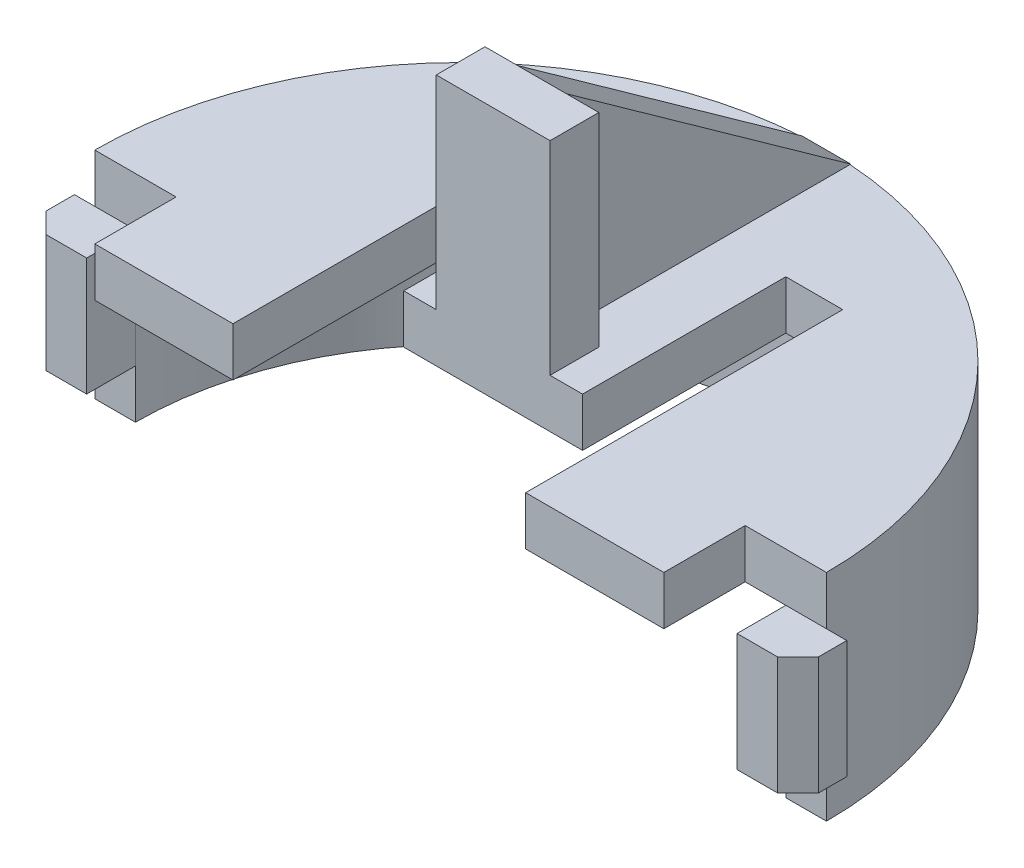
from build123d import *

# Parameters (mm, degrees)
REVOLVE1_ANGLE           = 180
SKETCH2_W                = 6.21
SKETCH2_H                = 1.5
CUT_EXTRUDE1_DEPTH       = 14.787313009
CUT_EXTRUDE2_DEPTH       = 14.787313009
SKETCH4_W                = 3.4
SKETCH4_H                = 2
BOSS_EXTRUDE1_DEPTH      = 1.2
SKETCH5_W                = 1.2
SKETCH5_H                = 2.9
BOSS_EXTRUDE2_DEPTH      = 1.5
CHAMFER1_SIZE            = 0.5
CHAMFER1_OF_MIRROR2_SIZE = 0.5
SKETCH6_W                = 2.8
SKETCH6_H                = 5
BOSS_EXTRUDE3_DEPTH      = 1.2
BOSS_EXTRUDE4_DEPTH      = 0.6


with BuildPart() as part:
    # Sketch1 → Revolve1 (revolve)
    with BuildSketch(Plane.XY):
        Polygon((8, 4.1), (8, 0), (9, 0), (9, 5.3), (0, 5.3), (0, 4.1), align=None)
    revolve(axis=Axis((0, 0, 0), (0, 1, 0)), revolution_arc=REVOLVE1_ANGLE)

    # Sketch2 → Cut-Extrude1 (cut, through all)
    with BuildSketch(Plane.XY):
        with Locations((0, 3.35)):
            Rectangle(SKETCH2_W, SKETCH2_H)
    extrude(amount=-CUT_EXTRUDE1_DEPTH, mode=Mode.SUBTRACT)

    # Sketch3 → Cut-Extrude2 (cut, through all)
    with BuildSketch(Plane(origin=(0, 5.3, 0), x_dir=(1, 0, 0), z_dir=(0, 1, 0))):
        Polygon((-2.2, 5.8), (-3.6, 5.8), (-3.6, 0), (3.6, 0), (3.6, 5.8), (2.2, 5.8), (2.2, 0.8), (-2.2, 0.8), align=None)
    extrude(amount=-CUT_EXTRUDE2_DEPTH, mode=Mode.SUBTRACT)

    # Sketch4 → Boss-Extrude1 (add)
    with BuildSketch(Plane(origin=(0, 5.3, 0), x_dir=(1, 0, 0), z_dir=(0, 1, 0))):
        with Locations((5.3, -1)):
            Rectangle(SKETCH4_W, SKETCH4_H)
        with Locations((-5.3, -1)):
            Rectangle(SKETCH4_W, SKETCH4_H)
    extrude(amount=-BOSS_EXTRUDE1_DEPTH)

    # Sketch5 → Boss-Extrude2 (add)
    with BuildSketch(Plane(origin=(8, 0, 0), x_dir=(0, 0, -1), z_dir=(1, 0, 0))):
        with Locations((-0.6, 2.65)):
            Rectangle(SKETCH5_W, SKETCH5_H)
    boss_extrude2 = extrude(amount=BOSS_EXTRUDE2_DEPTH)

    # Chamfer1
    chamfer1_edges = [part.edges().sort_by_distance(p)[0] for p in [
        (9.5, 2.65, 1.2),
    ]]
    chamfer(chamfer1_edges, length=CHAMFER1_SIZE)

    # Mirror2: Boss-Extrude2 across plane
    add(boss_extrude2.mirror(Plane(origin=(0, 0, 0), x_dir=(0, 0, 1), z_dir=(1, 0, 0))))

    # Chamfer1 of Mirror2
    chamfer1_of_mirror2_edges = [part.edges().sort_by_distance(p)[0] for p in [
        (-9.5, 2.65, 1.2),
    ]]
    chamfer(chamfer1_of_mirror2_edges, length=CHAMFER1_OF_MIRROR2_SIZE)

    # Sketch6 → Boss-Extrude3 (add)
    with BuildSketch(Plane.XY.offset(-0.8)):
        with Locations((0, 7.8)):
            Rectangle(SKETCH6_W, SKETCH6_H)
    extrude(amount=-BOSS_EXTRUDE3_DEPTH)

    # Sketch7 → Boss-Extrude4 (add, symmetric)
    with BuildSketch(Plane(origin=(0, 0, 0), x_dir=(0, 0, -1), z_dir=(1, 0, 0))):
        Polygon((2, 10.3), (9, 5.3), (2, 5.3), align=None)
    extrude(amount=BOSS_EXTRUDE4_DEPTH, both=True)


solid = part.part
